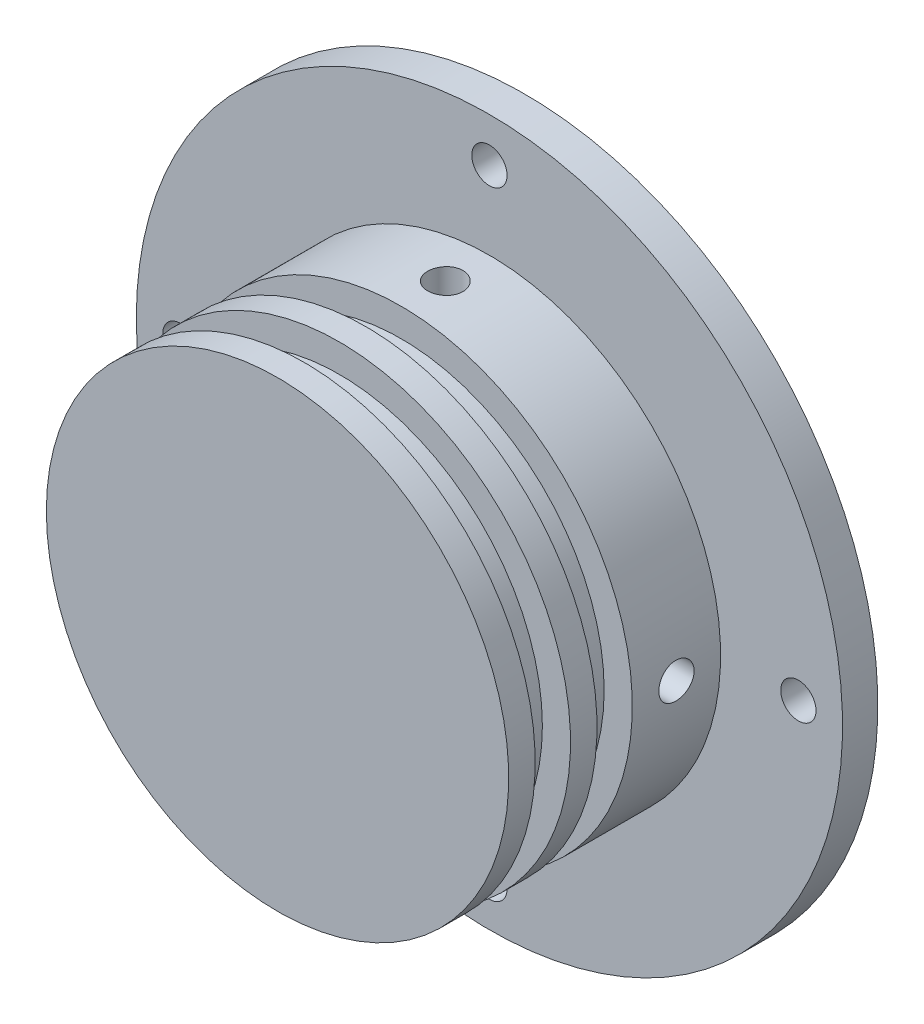
from build123d import *

# Parameters (mm, degrees)
F_4_0MM_DOWEL_HOLE2_D           = 4
F_4_0MM_DOWEL_HOLE2_ON_FACE_2_D = 4
F_4_0MM_DOWEL_HOLE2_ON_FACE_3_D = 4
F_4_0MM_DOWEL_HOLE2_ON_FACE_4_D = 4
F_4_0MM_DOWEL_HOLE3_D           = 4
F_4_0MM_DOWEL_HOLE3_DEPTH       = 8
F_4_0MM_DOWEL_HOLE3_TIP         = 1.201721238


with BuildPart() as part:
    # Sketch1 → Revolve1 (revolve)
    with BuildSketch(Plane(origin=(0, 0, 0), x_dir=(1, 0, 0), z_dir=(0, 1, 0))):
        Polygon((0, 6), (0, 0), (26.1874, 0), (26.1874, 3), (23, 3), (23, 7), (26.1874, 7), (26.1874, 10), (23, 10), (23, 14), (26.1874, 14), (26.1874, 24), (40, 24), (40, 28), (15, 28), (15, 6), align=None)
    revolve(axis=Axis((0, 0, -6), (0, 0, 1)))

    # Ø4.0mm Dowel Hole2 (through all)
    with Locations(Plane(origin=(0, 26.1874, -19), x_dir=(1, 0, 0), z_dir=(0, 1, 0))):
        with Locations((0, 0)):
            Hole(F_4_0MM_DOWEL_HOLE2_D / 2)

    # Ø4.0mm Dowel Hole2 on face 2 (through all)
    with Locations(Plane(origin=(26.1874, 0, -19), x_dir=(0, 0, 1), z_dir=(1, 0, 0))):
        with Locations((0, 0)):
            Hole(F_4_0MM_DOWEL_HOLE2_ON_FACE_2_D / 2)

    # Ø4.0mm Dowel Hole2 on face 3 (through all)
    with Locations(Plane(origin=(0, -26.1874, -19), x_dir=(0, 0, -1), z_dir=(0, -1, 0))):
        with Locations((0, 0)):
            Hole(F_4_0MM_DOWEL_HOLE2_ON_FACE_3_D / 2)

    # Ø4.0mm Dowel Hole2 on face 4 (through all)
    with Locations(Plane(origin=(-26.1874, 0, -19), x_dir=(0, 0, -1), z_dir=(-1, 0, 0))):
        with Locations((0, 0)):
            Hole(F_4_0MM_DOWEL_HOLE2_ON_FACE_4_D / 2)

    # Ø4.0mm Dowel Hole3
    with Locations(Plane.XY.offset(-24)):
        with Locations((0, 35), (35, 0), (0, -35), (-35, 0)):
            Hole(F_4_0MM_DOWEL_HOLE3_D / 2, depth=F_4_0MM_DOWEL_HOLE3_DEPTH)
            with Locations((0, 0, -(F_4_0MM_DOWEL_HOLE3_DEPTH + F_4_0MM_DOWEL_HOLE3_TIP / 2))):  # 118° drill point
                Cone(0, F_4_0MM_DOWEL_HOLE3_D / 2, F_4_0MM_DOWEL_HOLE3_TIP, mode=Mode.SUBTRACT)


solid = part.part
